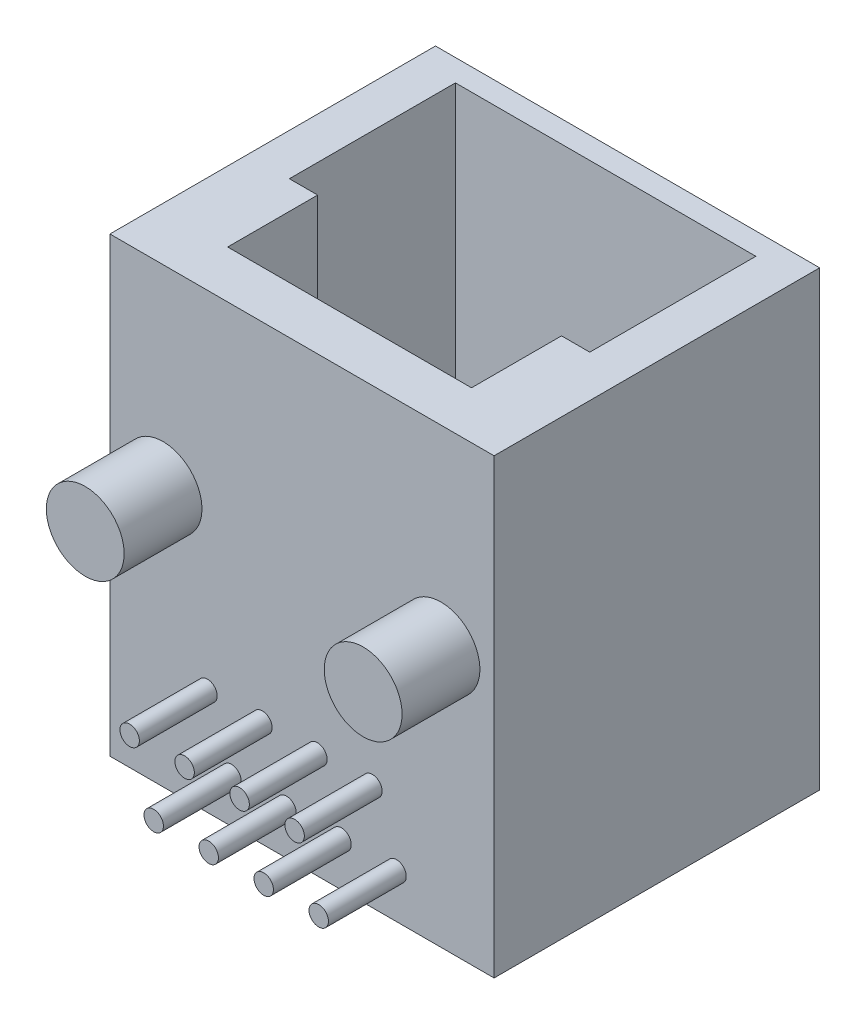
from build123d import *

# Parameters (mm, degrees)
SKETCH1_W           = 15.8
SKETCH1_H           = 13.39
BOSS_EXTRUDE1_DEPTH = 18.6
CUT_EXTRUDE1_DEPTH  = 14.6
SKETCH3_R           = 1.6
SKETCH3_R_2         = 0.4
BOSS_EXTRUDE2_DEPTH = 3.2


with BuildPart() as part:
    # Sketch1 → Boss-Extrude1 (new body)
    with BuildSketch(Plane(origin=(0, 0, 0), x_dir=(1, 0, 0), z_dir=(0, 1, 0))):
        Rectangle(SKETCH1_W, SKETCH1_H)
    extrude(amount=BOSS_EXTRUDE1_DEPTH)

    # Sketch2 → Cut-Extrude1 (cut)
    with BuildSketch(Plane(origin=(0, 18.6, 0), x_dir=(1, 0, 0), z_dir=(0, 1, 0))):
        Polygon((5.014873325, -1.036943504), (6.176965183, -1.036943504), (6.176965183, 5.792580953), (-6.176965183, 5.792580953), (-6.176965183, -1.036943504), (-5.014873325, -1.036943504), (-5.014873325, -4.737759113), (5.014873325, -4.737759113), align=None)
    extrude(amount=-CUT_EXTRUDE1_DEPTH, mode=Mode.SUBTRACT)

    # Sketch3 → Boss-Extrude2 (add)
    with BuildSketch(Plane.XY.offset(6.695)):
        with Locations((-5.715, 10.7)):
            Circle(SKETCH3_R)
        with Locations((5.715, 10.7)):
            Circle(SKETCH3_R)
        with Locations((2.89599, 4.35)):
            Circle(SKETCH3_R_2)
        with Locations((0.63401, 4.35)):
            Circle(SKETCH3_R_2)
        with Locations((-1.62797, 4.35)):
            Circle(SKETCH3_R_2)
        with Locations((3.88797, 1.81)):
            Circle(SKETCH3_R_2)
        with Locations((1.62599, 1.81)):
            Circle(SKETCH3_R_2)
        with Locations((-0.63599, 1.81)):
            Circle(SKETCH3_R_2)
        with Locations((-2.89797, 1.81)):
            Circle(SKETCH3_R_2)
        with Locations((-3.88797, 4.35)):
            Circle(SKETCH3_R_2)
    extrude(amount=BOSS_EXTRUDE2_DEPTH)


solid = part.part
